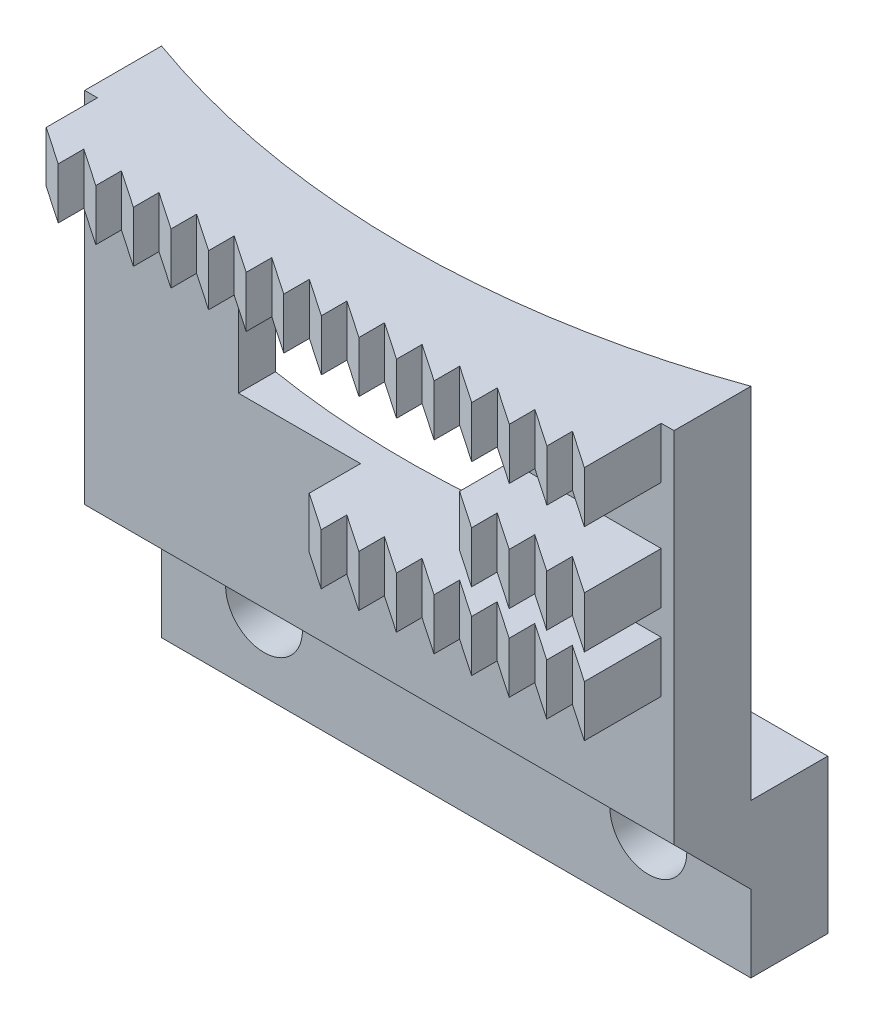
from build123d import *

# Parameters (mm, degrees)
CROQUIS1_W                 = 23
CROQUIS1_H                 = 6
CROQUIS1_R                 = 1.5
SALIENTE_EXTRUIR1_DEPTH    = 3
RECUBRIR1_DEPTH            = 23
CROQUIS2_R                 = 1.5
CORTAR_EXTRUIR1_DEPTH      = 3
CROQUIS3_R                 = 34.0625
CORTAR_EXTRUIR2_DEPTH      = 14
SALIENTE_EXTRUIR2_DEPTH    = 2
SALIENTE_EXTRUIR3_DEPTH    = 2
CROQUIS8_W                 = 11.736
CROQUIS8_H                 = 2
SALIENTE_EXTRUIR4_DEPTH    = 2
CORTAR_EXTRUIR3_REACH      = 33.064
CORTAR_EXTRUIR3_END_RADIUS = 34.0625


# Read off the part's stored shape, not the designer's step: Recubrir1
with BuildPart() as part:
    # Croquis1 → Saliente-Extruir1 (new body)
    with BuildSketch(Plane.XY):
        with Locations((11.5, 3)):
            Rectangle(CROQUIS1_W, CROQUIS1_H)
        with Locations((4, 3)):
            Circle(CROQUIS1_R, mode=Mode.SUBTRACT)
        with Locations((19, 3)):
            Circle(CROQUIS1_R, mode=Mode.SUBTRACT)
    extrude(amount=SALIENTE_EXTRUIR1_DEPTH)

    # Recubrir1 outline → Recubrir1 (add)
    with BuildSketch(Plane.YZ):
        Polygon((3, 3), (20, 3), (20, 6), (6, 6), align=None)
    extrude(amount=RECUBRIR1_DEPTH)

    # Croquis2 → Cortar-Extruir1 (cut)
    with BuildSketch(Plane.XY.offset(3)):
        with Locations((4, 3)):
            Circle(CROQUIS2_R)
        with Locations((19, 3)):
            Circle(CROQUIS2_R)
    extrude(amount=CORTAR_EXTRUIR1_DEPTH, mode=Mode.SUBTRACT)

    # Croquis3 → Cortar-Extruir2 (cut)
    with BuildSketch(Plane(origin=(0, 20, 0), x_dir=(1, 0, 0), z_dir=(0, 1, 0))):
        with Locations((11.5, 29.0625)):
            Circle(CROQUIS3_R)
    extrude(amount=-CORTAR_EXTRUIR2_DEPTH, mode=Mode.SUBTRACT)

    # Croquis6 → Saliente-Extruir2 (add)
    with BuildSketch(Plane(origin=(0, 20, 0), x_dir=(1, 0, 0), z_dir=(0, 1, 0))):
        Polygon((22.5, -6), (0.5, -6), (0.5, -8), (1.967, -9), (1.967, -8), (3.434, -9), (3.434, -8), (4.901, -9), (4.901, -8), (6.368, -9), (6.368, -8), (7.835, -9), (7.835, -8), (9.302, -9), (9.302, -8), (10.769, -9), (10.769, -8), (12.236, -9), (12.236, -8), (13.703, -9), (13.703, -8), (15.17, -9), (15.17, -8), (16.637, -9), (16.637, -8), (18.104, -9), (18.104, -8), (19.571, -9), (19.571, -8), (21.038, -9), (21.038, -8), (22.5, -9), align=None)
    extrude(amount=-SALIENTE_EXTRUIR2_DEPTH)

    # Croquis7 → Saliente-Extruir3 (add)
    with BuildSketch(Plane(origin=(0, 15.767364365, 0), x_dir=(1, 0, 0), z_dir=(0, 1, 0))):
        Polygon((18.099, -9), (18.099, -8), (19.566, -9), (19.566, -8), (21.033, -9), (21.033, -8), (22.5, -9), (22.5, -6), (16.632, -6), (16.632, -8), align=None)
    extrude(amount=-SALIENTE_EXTRUIR3_DEPTH)

    # Croquis8 → Saliente-Extruir4 (add)
    with BuildSketch(Plane(origin=(0, 12.767364365, 0), x_dir=(1, 0, 0), z_dir=(0, 1, 0))):
        with Locations((16.632, -7)):
            Rectangle(CROQUIS8_W, CROQUIS8_H)
        Polygon((15.165, -8), (13.698, -8), (15.165, -9), align=None)
        Polygon((13.698, -8), (12.231, -8), (13.698, -9), align=None)
        Polygon((12.231, -8), (10.764, -8), (12.231, -9), align=None)
        Polygon((16.632, -9), (16.632, -8), (15.165, -8), align=None)
        Polygon((18.099, -9), (18.099, -8), (16.632, -8), align=None)
        Polygon((19.566, -9), (19.566, -8), (18.099, -8), align=None)
        Polygon((21.033, -9), (21.033, -8), (19.566, -8), align=None)
        Polygon((22.5, -9), (22.5, -8), (21.033, -8), align=None)
    extrude(amount=-SALIENTE_EXTRUIR4_DEPTH)

    # Cortar-Extruir3: up to this cylinder (the profile starts outside it)
    cortar_extruir3_end = Plane(origin=(11.5, 15.383682, -29.0625), z_dir=(0, 1, 0)) * Cylinder(CORTAR_EXTRUIR3_END_RADIUS, 135.253, mode=Mode.PRIVATE)
    # Croquis9 → Cortar-Extruir3 (cut, up to the surface)
    with BuildSketch(Plane.XY.offset(6), mode=Mode.PRIVATE) as cortar_extruir3_sk1:
        Polygon((10.764, 12.767364365), (16.632, 12.767364365), (16.632, 13.767364365), (16.632, 15.767364365), (16.632, 18), (6, 18), (6, 12.767364365), align=None)
    cortar_extruir3_tool1 = extrude(cortar_extruir3_sk1.sketch, amount=-CORTAR_EXTRUIR3_REACH, mode=Mode.PRIVATE) - cortar_extruir3_end
    add(cortar_extruir3_tool1.solids().sort_by_distance((11.316, 15.383682, 6))[0], mode=Mode.SUBTRACT)


solid = part.part
